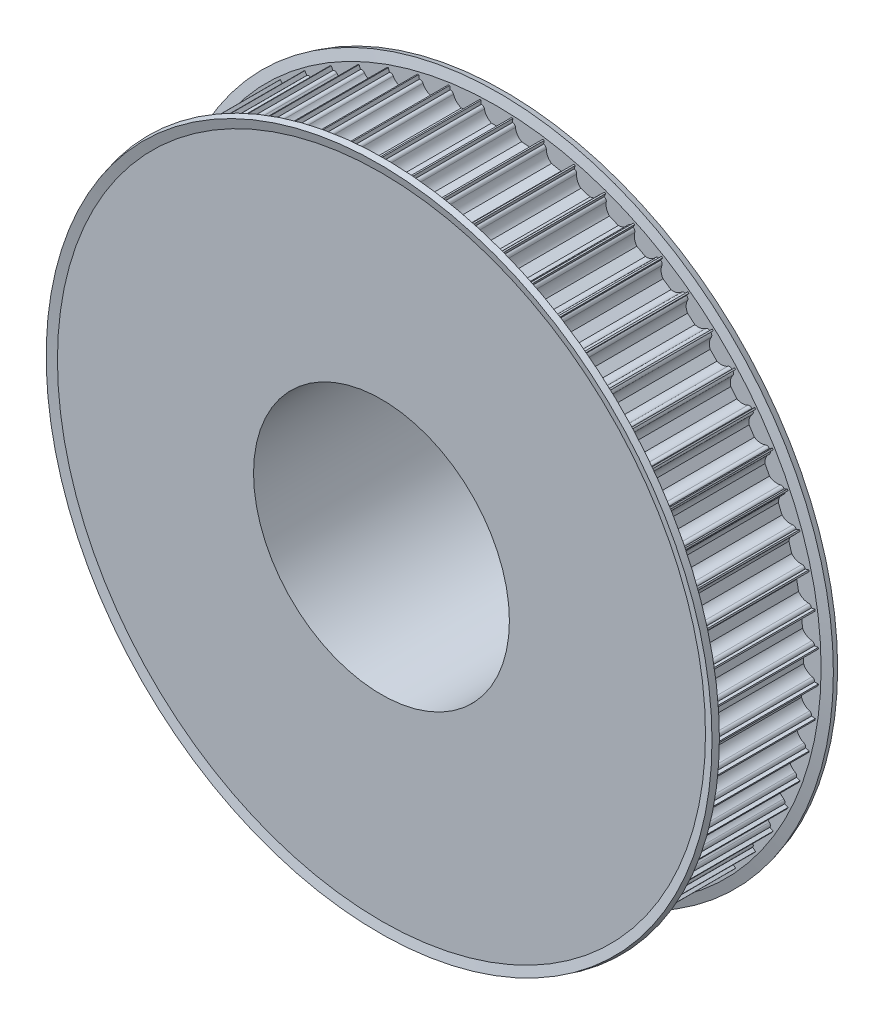
from build123d import *

# Parameters (mm, degrees)
CUT_EXTRUDE1_DEPTH = 122.757956619
CIRPATTERN1_COUNT  = 64


with BuildPart() as part:
    # Sketch1 → Revolve1 (revolve)
    with BuildSketch(Plane(origin=(0, 0, 0), x_dir=(0, 0, -1), z_dir=(1, 0, 0))):
        Polygon((0, 31.75), (0, 80), (30, 80), (30, 47.25), (45, 47.25), (45, 31.75), align=None)
    revolve(axis=Axis((0, 0, 29.536098978), (0, 0, -1)))

    # Sketch2 → Cut-Extrude1 (cut, through all)
    with BuildSketch(Plane.XY):
        with BuildLine():
            Line((3.674234614, 79), (3.75, 79))
            Line((3.75, 79), (3.75, 81))
            Line((3.75, 81), (-3.75, 81))
            Line((-3.75, 81), (-3.75, 79))
            Line((-3.75, 79), (-3.674234614, 79))
            ThreePointArc((-3.674234614, 79), (-3.199892965, 78.830947502), (-2.939387691, 78.4))
            ThreePointArc((-2.939387691, 78.4), (-2.331759211, 77.112435701), (-1.198957881, 76.25))
            Line((-1.198957881, 76.25), (1.198957881, 76.25))
            ThreePointArc((1.198957881, 76.25), (2.331759211, 77.112435701), (2.939387691, 78.4))
            ThreePointArc((2.939387691, 78.4), (3.199892965, 78.830947502), (3.674234614, 79))
        make_face()
    cut_extrude1 = extrude(amount=-CUT_EXTRUDE1_DEPTH, mode=Mode.SUBTRACT)

    # CirPattern1: Cut-Extrude1 ×64 about axis
    cirpattern1_axis = Axis((0, 0, 21.209859057), (0, 0, -1))
    for i in range(1, CIRPATTERN1_COUNT):
        add(cut_extrude1.rotate(cirpattern1_axis, i * 360 / CIRPATTERN1_COUNT), mode=Mode.SUBTRACT)

    # Sketch4 → Revolve2 (revolve)
    with BuildSketch(Plane(origin=(0, 0, 0), x_dir=(0, 0, -1), z_dir=(1, 0, 0))):
        Polygon((-0.591966801, 82.623832474), (0, 80.414582296), (0, 75.612061042), (1.5, 75.612061042), (1.5, 80.612061042), (0.856921938, 83.012061042), align=None)
        Polygon((30.591966801, 82.623832474), (29.143078062, 83.012061042), (28.5, 80.612061042), (28.5, 75.612061042), (30, 75.612061042), (30, 80.414582296), align=None)
    revolve(axis=Axis((0, 0, 21.209859057), (0, 0, -1)))


solid = part.part
